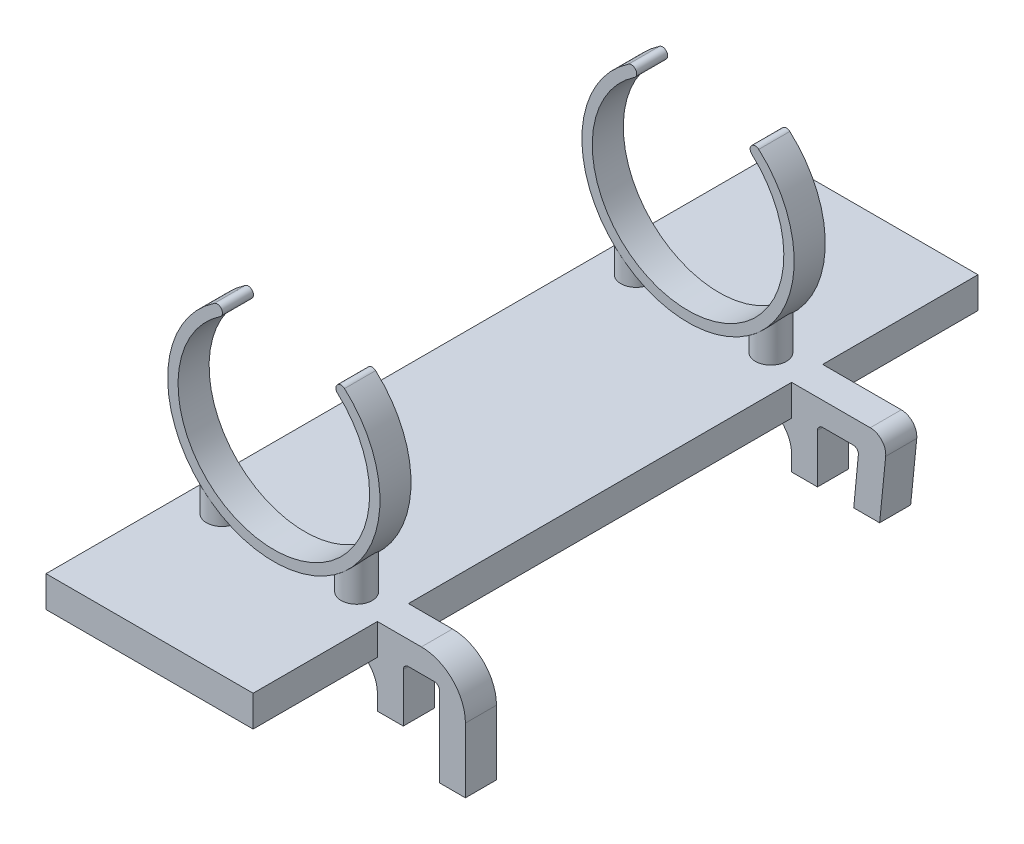
from build123d import *

# Parameters (mm, degrees)
BOSS_EXTRUDE1_DEPTH      = 3
LPATTERN1_COUNT          = 2
LPATTERN1_PITCH          = 40
SKETCH2_W                = 20
SKETCH2_H                = 70
BOSS_EXTRUDE2_DEPTH      = 3
FILLET1_R                = 3
BOSS_EXTRUDE3_DEPTH      = 3
FILLET2_START            = -1
FILLET2_DEPTH            = 5
FILLET3_DEPTH            = 3
BOSS_EXTRUDE5_REACH      = 65.784
BOSS_EXTRUDE5_END_RADIUS = 10.25
SKETCH5_R                = 1.5
LPATTERN2_START          = 40
LPATTERN2_DEPTH          = 3
LPATTERN2_START_2        = 7.5
LPATTERN2_2_OUTLINE_R    = 1.5
LPATTERN2_2_DEPTH        = 1.302234895
LPATTERN2_START_3        = 8.802234895
LPATTERN2_3_OUTLINE_R    = 1.5
LPATTERN2_3_DEPTH        = 2.539759791
LPATTERN2_START_4        = 39
LPATTERN2_4_DEPTH        = 5
LPATTERN2_5_OUTLINE_R    = 1.5
LPATTERN2_5_DEPTH        = 1.302235223
LPATTERN2_START_5        = 8.802235223
LPATTERN2_6_OUTLINE_R    = 1.5
LPATTERN2_6_DEPTH        = 2.539761855
LPATTERN2_7_OUTLINE_W    = 10.25
LPATTERN2_7_OUTLINE_H    = 3.000220265
LPATTERN2_7_ANGLE        = 22.115218
CUT_EXTRUDE2_DEPTH       = 64.922422006
CUT_EXTRUDE2_DEPTH_BACK  = 64.922422006
SKETCH6_W                = 3.5
SKETCH6_H                = 1.978060381
FILLET4_R                = 0.5
SKETCH7_W                = 2.5
SKETCH7_H                = 3
BOSS_EXTRUDE6_DEPTH      = 3
SKETCH8_R                = 0.75
CUT_EXTRUDE3_DEPTH       = 5
CUT_EXTRUDE4_START       = -3
CUT_EXTRUDE4_DEPTH       = 3
BOSS_EXTRUDE7_DEPTH      = 3
FILLET5_R                = 0.5
FILLET6_R                = 1.5


with BuildPart() as part:
    # Sketch1 → Boss-Extrude1 (new body)
    with BuildSketch(Plane.XY):
        with BuildLine():
            Line((0, 3.25), (0, 0))
            Line((0, 0), (2.5, 0))
            Line((2.5, 0), (2.5, 3.25))
            ThreePointArc((2.5, 3.25), (1.25520382, 6.25520382), (-1.75, 7.5))
            Line((-1.75, 7.5), (-6, 7.5))
            Line((-6, 7.5), (-6, 3.25))
            Line((-6, 3.25), (-6, 0))
            Line((-6, 0), (-3.5, 0))
            Line((-3.5, 0), (-3.5, 3.25))
            ThreePointArc((-3.5, 3.25), (-1.75, 5), (0, 3.25))
        make_face()
    extrude(amount=BOSS_EXTRUDE1_DEPTH)


with BuildPart() as lpattern1_1:
    # LPattern1: pattern copy
    add(part.part.moved(Location(Vector(0, 0, 1) * (1 * LPATTERN1_PITCH))))


with BuildPart() as part_1:
    add(part.part)

    add(lpattern1_1.part)  # Boss-Extrude2 merges LPattern1_1
    # Sketch2 → Boss-Extrude2 (add)
    with BuildSketch(Plane(origin=(0, 7.5, 0), x_dir=(1, 0, 0), z_dir=(0, 1, 0))):
        with Locations((-16, -20)):
            Rectangle(SKETCH2_W, SKETCH2_H)
    extrude(amount=-BOSS_EXTRUDE2_DEPTH)

    # Fillet1
    fillet1_edges = [part_1.edges().sort_by_distance(p)[0] for p in [
        (-6, 4.5, 1.5),
        (-6, 4.5, 41.5),
    ]]
    fillet(fillet1_edges, radius=FILLET1_R)

    # Sketch6 → Cut-Extrude2 (cut, two sides: drawn at the far end of the back side and taken through both)
    with BuildSketch(Plane.XY.offset(3).offset(-CUT_EXTRUDE2_DEPTH_BACK)):
        with Locations((-1.75, 4.239030191)):
            Rectangle(SKETCH6_W, SKETCH6_H)
    extrude(amount=CUT_EXTRUDE2_DEPTH + CUT_EXTRUDE2_DEPTH_BACK, mode=Mode.SUBTRACT)

    # Fillet4
    fillet4_edges = [part_1.edges().sort_by_distance(p)[0] for p in [
        (-3.5, 5.228060381, 1.5),
        (-3.5, 5.228060381, 41.5),
        (0, 5.228060381, 1.5),
        (0, 5.228060381, 41.5),
    ]]
    fillet(fillet4_edges, radius=FILLET4_R)

    # Sketch7 → Boss-Extrude6 (add)
    with BuildSketch(Plane.XY.offset(43)):
        with Locations((1.25, -1.5)):
            Rectangle(SKETCH7_W, SKETCH7_H)
    extrude(amount=-BOSS_EXTRUDE6_DEPTH)

    # Sketch8 → Cut-Extrude3 (cut)
    with BuildSketch(Plane.ZY.offset(26)):
        with Locations((-5, 6)):
            Circle(SKETCH8_R)
        with Locations((20, 6)):
            Circle(SKETCH8_R)
        with Locations((45, 6)):
            Circle(SKETCH8_R)
    extrude(amount=-CUT_EXTRUDE3_DEPTH, mode=Mode.SUBTRACT)

    # Sketch9 → Cut-Extrude4 (cut)
    with BuildSketch(Plane(origin=(0, 0, 0), x_dir=(-1, 0, 0), z_dir=(0, 0, -1)).offset(CUT_EXTRUDE4_START)):
        with BuildLine():
            Line((0, 0), (0.5, 5.228060381))
            ThreePointArc((0.5, 5.228060381), (0.146446609, 5.081613772), (0, 4.728060381))
            Line((0, 4.728060381), (0, 0))
        make_face()
        with BuildLine():
            Line((0.5, 5.228060381), (-0.5, 5.228060381))
            Line((-0.5, 5.228060381), (0, 0))
            Line((0, 0), (0, 4.728060381))
            ThreePointArc((0, 4.728060381), (0.146446609, 5.081613772), (0.5, 5.228060381))
        make_face()
    extrude(amount=CUT_EXTRUDE4_DEPTH, mode=Mode.SUBTRACT)

    # Sketch9<3> → Boss-Extrude7 (add)
    with BuildSketch(Plane(origin=(0, 0, 0), x_dir=(-1, 0, 0), z_dir=(0, 0, -1))):
        with BuildLine():
            Line((1.75, 7.5), (-3.25, 7.5))
            Line((-3.25, 7.5), (-2.5, 0))
            Line((-2.5, 0), (-2.5, 3.25))
            ThreePointArc((-2.5, 3.25), (-1.25520382, 6.25520382), (1.75, 7.5))
        make_face()
    extrude(amount=-BOSS_EXTRUDE7_DEPTH)

    # Fillet5
    fillet5_edges = [part_1.edges().sort_by_distance(p)[0] for p in [
        (0.5, 5.228060381, 1.5),
    ]]
    fillet(fillet5_edges, radius=FILLET5_R)

    # Fillet6
    fillet6_edges = [part_1.edges().sort_by_distance(p)[0] for p in [
        (3.25, 7.5, 1.5),
    ]]
    fillet(fillet6_edges, radius=FILLET6_R)


with BuildPart() as body_2:
    # Sketch4 → Boss-Extrude3 (new body)
    with BuildSketch(Plane.XY.offset(3)):
        with BuildLine():
            Line((-20.857798696, 25.621740076), (-21.206324936, 26.579308051))
            ThreePointArc((-21.206324936, 26.579308051), (-16.672163531, 7.522062955), (-9.682947675, 25.822010278))
            Line((-9.682947675, 25.822010278), (-10.11803023, 24.888972729))
            ThreePointArc((-10.11803023, 24.888972729), (-16.629657521, 8.521455618), (-20.857798696, 25.621740076))
        make_face()
    extrude(amount=-BOSS_EXTRUDE3_DEPTH)

    # Fillet2: read off the stored shape, not the designer's step
    # Fillet2 outline → Fillet2 (cut)
    with BuildSketch(Plane.XY.offset(FILLET2_START)):
        with BuildLine():
            add(Edge.make_bspline(
                [(-20.994076432, 25.996160077), (-21.074153595, 26.216170321), (-21.251523965, 26.350710286), (-21.454646821, 26.373043505), (-21.624101617, 26.320471493), (-21.744123922, 26.239260296)],
                knots=[0.438237279, 0.438237279, 0.438237279, 0.438237279, 0.438237279, 0.438237279, 1, 1, 1, 1, 1, 1], degree=5, weights=[0.507629267, 0.479872472, 0.515231147, 0.613705294, 0.775294911, 1]))
            Line((-20.994076432, 25.996160077), (-21.206324936, 26.579308051))
            ThreePointArc((-21.206324936, 26.579308051), (-21.477863695, 26.413458278), (-21.744123922, 26.239260296))
        make_face()
        with BuildLine():
            add(Edge.make_bspline(
                [(-21.183721588, 25.411039779), (-21.095700521, 25.470597844), (-21.011417818, 25.561339411), (-20.949957611, 25.687250869), (-20.937439038, 25.840550084), (-20.994076432, 25.996160077)],
                knots=[0, 0, 0, 0, 0, 0, 0.438237279, 0.438237279, 0.438237279, 0.438237279, 0.438237279, 0.438237279], degree=5, weights=[1, 0.824705088, 0.687820559, 0.589346413, 0.529282649, 0.507629267]))
            ThreePointArc((-21.183721588, 25.411039779), (-21.021865296, 25.518099442), (-20.857798696, 25.621740076))
            Line((-20.857798696, 25.621740076), (-20.994076432, 25.996160077))
        make_face()
    extrude(amount=FILLET2_DEPTH, mode=Mode.SUBTRACT)

    # Fillet3: read off the stored shape, not the designer's step
    # Fillet3 outline → Fillet3 (cut)
    with BuildSketch(Plane.XY):
        with BuildLine():
            add(Edge.make_bspline(
                [(-9.171518011, 25.394235327), (-9.282578146, 25.493443697), (-9.44922289, 25.569577268), (-9.660410728, 25.570842005), (-9.856114015, 25.450653826), (-9.957768573, 25.23265496)],
                knots=[0, 0, 0, 0, 0, 0, 0.573717386, 0.573717386, 0.573717386, 0.573717386, 0.573717386, 0.573717386], degree=5, weights=[1, 0.770513046, 0.606856419, 0.50903012, 0.477034149, 0.510868506]))
            ThreePointArc((-9.171518011, 25.394235327), (-9.423753658, 25.612282369), (-9.682947675, 25.822010278))
            Line((-9.682947675, 25.822010278), (-9.957768573, 25.23265496))
        make_face()
        with BuildLine():
            add(Edge.make_bspline(
                [(-9.957768573, 25.23265496), (-10.024989519, 25.088499201), (-10.028130695, 24.940896848), (-9.983698166, 24.813907164), (-9.914364214, 24.716929113), (-9.837711376, 24.648456271)],
                knots=[0.573717386, 0.573717386, 0.573717386, 0.573717386, 0.573717386, 0.573717386, 1, 1, 1, 1, 1, 1], degree=5, weights=[0.510868506, 0.536008058, 0.597490983, 0.695317282, 0.829486954, 1]))
            Line((-9.957768573, 25.23265496), (-10.11803023, 24.888972729))
            ThreePointArc((-10.11803023, 24.888972729), (-9.976670181, 24.770113809), (-9.837711376, 24.648456271))
        make_face()
    extrude(amount=FILLET3_DEPTH, mode=Mode.SUBTRACT)


with BuildPart() as body_3:
    # Boss-Extrude5: up to this cylinder (the profile starts outside it)
    boss_extrude5_end = Plane(origin=(-16, 17.75, 1.5), z_dir=(0, 0, 1)) * Cylinder(BOSS_EXTRUDE5_END_RADIUS, 153.068, mode=Mode.PRIVATE)
    # Sketch5 → Boss-Extrude5 (new, up to the surface)
    with BuildSketch(Plane(origin=(0, 7.5, 0), x_dir=(1, 0, 0), z_dir=(0, 1, 0)), mode=Mode.PRIVATE) as boss_extrude5_sk1:
        with Locations(Location((-22.5, -1.5, 0), (0, 0, 90))):
            Circle(SKETCH5_R)
    boss_extrude5_tool1 = extrude(boss_extrude5_sk1.sketch, amount=BOSS_EXTRUDE5_REACH, mode=Mode.PRIVATE) - boss_extrude5_end
    add(boss_extrude5_tool1.solids().sort_by_distance((-22.5, 7.5, 1.5))[0])
    # Sketch5 → Boss-Extrude5 (new, up to the surface)
    with BuildSketch(Plane(origin=(0, 7.5, 0), x_dir=(1, 0, 0), z_dir=(0, 1, 0)), mode=Mode.PRIVATE) as boss_extrude5_sk2:
        with Locations(Location((-9.5, -1.5, 0), (0, 0, 90))):
            Circle(SKETCH5_R)
    boss_extrude5_tool2 = extrude(boss_extrude5_sk2.sketch, amount=BOSS_EXTRUDE5_REACH, mode=Mode.PRIVATE) - boss_extrude5_end
    add(boss_extrude5_tool2.solids().sort_by_distance((-9.5, 7.5, 1.5))[0])


with BuildPart() as body_4:
    # LPattern2: read off the stored shape, not the designer's step
    # LPattern2 outline → LPattern2 (new body)
    with BuildSketch(Plane.XY.offset(LPATTERN2_START)):
        with BuildLine():
            ThreePointArc((-21.744123922, 26.239260296), (-16.687368099, 7.523073526), (-9.171518011, 25.394235327))
            add(Edge.make_bspline(
                [(-9.171518011, 25.394235327), (-9.42011103, 25.616299782), (-9.897400645, 25.707435586), (-10.230497327, 25.334546058), (-10.086304395, 24.870520725), (-9.837711376, 24.648456271)],
                knots=[0, 0, 0, 0, 0, 0, 1, 1, 1, 1, 1, 1], degree=5, weights=[1, 0.6, 0.4, 0.4, 0.6, 1]))
            ThreePointArc((-9.837711376, 24.648456271), (-16.620307797, 8.520822451), (-21.183721588, 25.41103978))
            add(Edge.make_bspline(
                [(-21.183721588, 25.41103978), (-20.907648082, 25.597840557), (-20.702656783, 26.038396659), (-20.98285795, 26.452506918), (-21.468050416, 26.426061074), (-21.744123922, 26.239260296)],
                knots=[0, 0, 0, 0, 0, 0, 1, 1, 1, 1, 1, 1], degree=5, weights=[1, 0.6, 0.4, 0.4, 0.6, 1]))
        make_face()
    extrude(amount=LPATTERN2_DEPTH)


with BuildPart() as body_5:
    # LPattern2 2 outline → LPattern2 2 (new body)
    with BuildSketch(Plane(origin=(0, 0, 0), x_dir=(1, 0, 0), z_dir=(0, 1, 0)).offset(LPATTERN2_START_2)):
        with Locations((-22.5, -41.5)):
            Circle(LPATTERN2_2_OUTLINE_R)
    extrude(amount=LPATTERN2_2_DEPTH)

    # LPattern2 3 outline → LPattern2 3 (add)
    with BuildSketch(Plane(origin=(0, 0, 0), x_dir=(1, 0, 0), z_dir=(0, 1, 0)).offset(LPATTERN2_START_3)):
        with Locations((-22.5, -41.5)):
            Circle(LPATTERN2_3_OUTLINE_R)
    extrude(amount=LPATTERN2_3_DEPTH)

    # LPattern2 4 outline → LPattern2 4 (cut)
    with BuildSketch(Plane.XY.offset(LPATTERN2_START_4)):
        with BuildLine():
            Line((-20, 11.341994686), (-23.999998778, 11.341995665))
            ThreePointArc((-23.999998778, 11.341995665), (-22.622702211, 9.926809128), (-20.999584885, 8.802002963))
            Line((-20.999584885, 8.802002963), (-20, 8.243497024))
            Line((-20, 8.243497024), (-20, 11.341994686))
        make_face()
    extrude(amount=LPATTERN2_4_DEPTH, mode=Mode.SUBTRACT)


with BuildPart() as body_6:
    # LPattern2 5 outline → LPattern2 5 (new body)
    with BuildSketch(Plane(origin=(0, 0, 0), x_dir=(1, 0, 0), z_dir=(0, 1, 0)).offset(LPATTERN2_START_2)):
        with Locations((-9.5, -41.5)):
            Circle(LPATTERN2_5_OUTLINE_R)
    extrude(amount=LPATTERN2_5_DEPTH)

    # LPattern2 6 outline → LPattern2 6 (add)
    with BuildSketch(Plane(origin=(0, 0, 0), x_dir=(1, 0, 0), z_dir=(0, 1, 0)).offset(LPATTERN2_START_5)):
        with Locations((-9.5, -41.5)):
            Circle(LPATTERN2_6_OUTLINE_R)
    extrude(amount=LPATTERN2_6_DEPTH)

    # LPattern2 7 outline → LPattern2 7 (revolve, cut)
    with BuildSketch(Plane(origin=(-16, 17.75, 0), x_dir=(0.4877650283417417, -0.8729749579035929, 0), z_dir=(-0.8729749579035929, -0.4877650283417417, 0))):
        with Locations((5.125, 41.500109978)):
            Rectangle(LPATTERN2_7_OUTLINE_W, LPATTERN2_7_OUTLINE_H)
    revolve(axis=Axis((-16, 17.75, 0), (0, 0, 1)), revolution_arc=LPATTERN2_7_ANGLE, mode=Mode.SUBTRACT)


solid = Compound([part_1.part, body_2.part, body_3.part, body_4.part, body_5.part, body_6.part])
